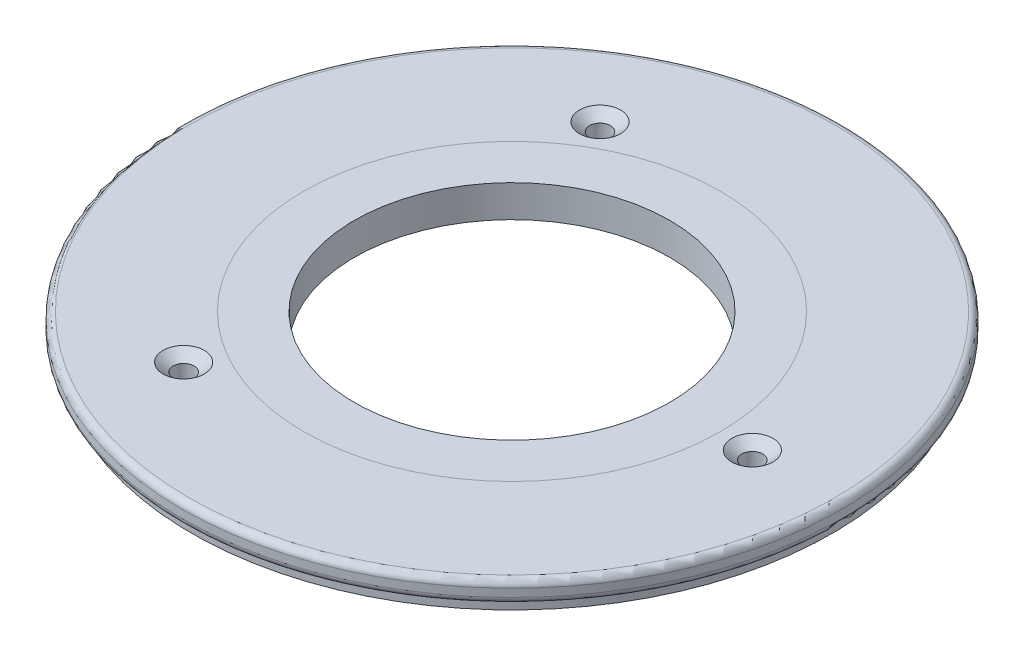
from build123d import *

# Parameters (mm, degrees)
SKETCH1_R                                          = 78.359
SKETCH1_R_2                                        = 37.5031
BOSS_EXTRUDE1_DEPTH                                = 7.62
CSK_FOR_10_FLAT_HEAD_MACHINE_SCREW_100_D           = 4.9784
CSK_FOR_10_FLAT_HEAD_MACHINE_SCREW_100_CSINK_D     = 9.779
CSK_FOR_10_FLAT_HEAD_MACHINE_SCREW_100_CSINK_ANGLE = 100
CIRPATTERN1_COUNT                                  = 3
SKETCH6_R                                          = 78.359
SKETCH6_R_2                                        = 76.1746
CUT_EXTRUDE1_DEPTH                                 = 2.54
FILLET1_R                                          = 1.5875


with BuildPart() as part:
    # Sketch1 → Boss-Extrude1 (new body)
    with BuildSketch(Plane(origin=(0, 0, 0), x_dir=(1, 0, 0), z_dir=(0, 1, 0))):
        Circle(SKETCH1_R)
        Circle(SKETCH1_R_2, mode=Mode.SUBTRACT)
    extrude(amount=BOSS_EXTRUDE1_DEPTH)

    # CSK for #10 Flat Head Machine Screw (100)1 (through all)
    with Locations(Plane(origin=(0, 7.62, 0), x_dir=(1, 0, 0), z_dir=(0, 1, 0))):
        with Locations((57.15, 0)):
            csk_for_10_flat_head_machine_screw_100 = CounterSinkHole(CSK_FOR_10_FLAT_HEAD_MACHINE_SCREW_100_D / 2, CSK_FOR_10_FLAT_HEAD_MACHINE_SCREW_100_CSINK_D / 2, counter_sink_angle=CSK_FOR_10_FLAT_HEAD_MACHINE_SCREW_100_CSINK_ANGLE)

    # CirPattern1: CSK for #10 Flat Head Machine Screw (100)1 ×3 about axis
    cirpattern1_axis = Axis((0, 7.62, 0), (0, 1, 0))
    for i in range(1, CIRPATTERN1_COUNT):
        add(csk_for_10_flat_head_machine_screw_100.rotate(cirpattern1_axis, i * 360 / CIRPATTERN1_COUNT), mode=Mode.SUBTRACT)

    # Sketch6 → Cut-Extrude1 (cut)
    with BuildSketch(Plane.XZ):
        Circle(SKETCH6_R)
        Circle(SKETCH6_R_2, mode=Mode.SUBTRACT)
    extrude(amount=-CUT_EXTRUDE1_DEPTH, mode=Mode.SUBTRACT)

    # Fillet1
    fillet1_edges = [part.edges().sort_by_distance(p)[0] for p in [
        (-78.359, 2.54, 0),
        (-78.359, 7.62, 0),
    ]]
    fillet(fillet1_edges, radius=FILLET1_R)


solid = part.part
